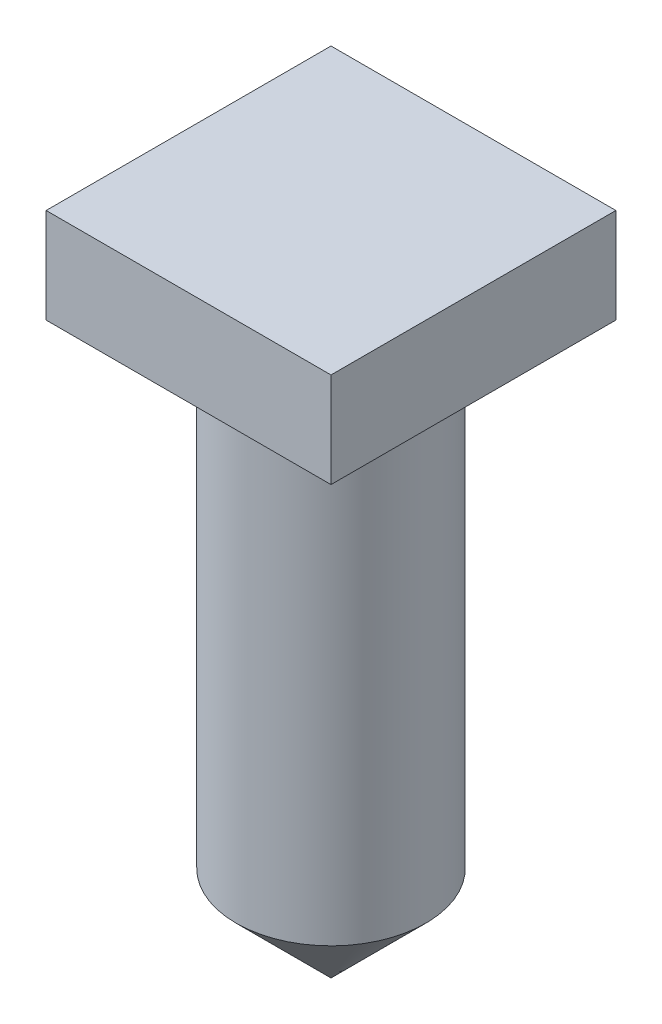
from build123d import *

# Parameters (mm, degrees)
CROQUIS2_W              = 6
CROQUIS2_H              = 6
SALIENTE_EXTRUIR2_DEPTH = 2


# Read off the part's stored shape, not the designer's step: Saliente-Extruir1
with BuildPart() as part:
    # Saliente-Extruir1 outline → Saliente-Extruir1 (revolve)
    with BuildSketch(Plane.XY):
        Polygon((0, 10), (0, -2), (2, 0), (2, 10), align=None)
    revolve(axis=Axis((0, 0, 0), (0, 1, 0)))

    # Croquis2 → Saliente-Extruir2 (add)
    with BuildSketch(Plane(origin=(0, 10, 0), x_dir=(1, 0, 0), z_dir=(0, 1, 0))):
        Rectangle(CROQUIS2_W, CROQUIS2_H)
    extrude(amount=SALIENTE_EXTRUIR2_DEPTH)


solid = part.part
